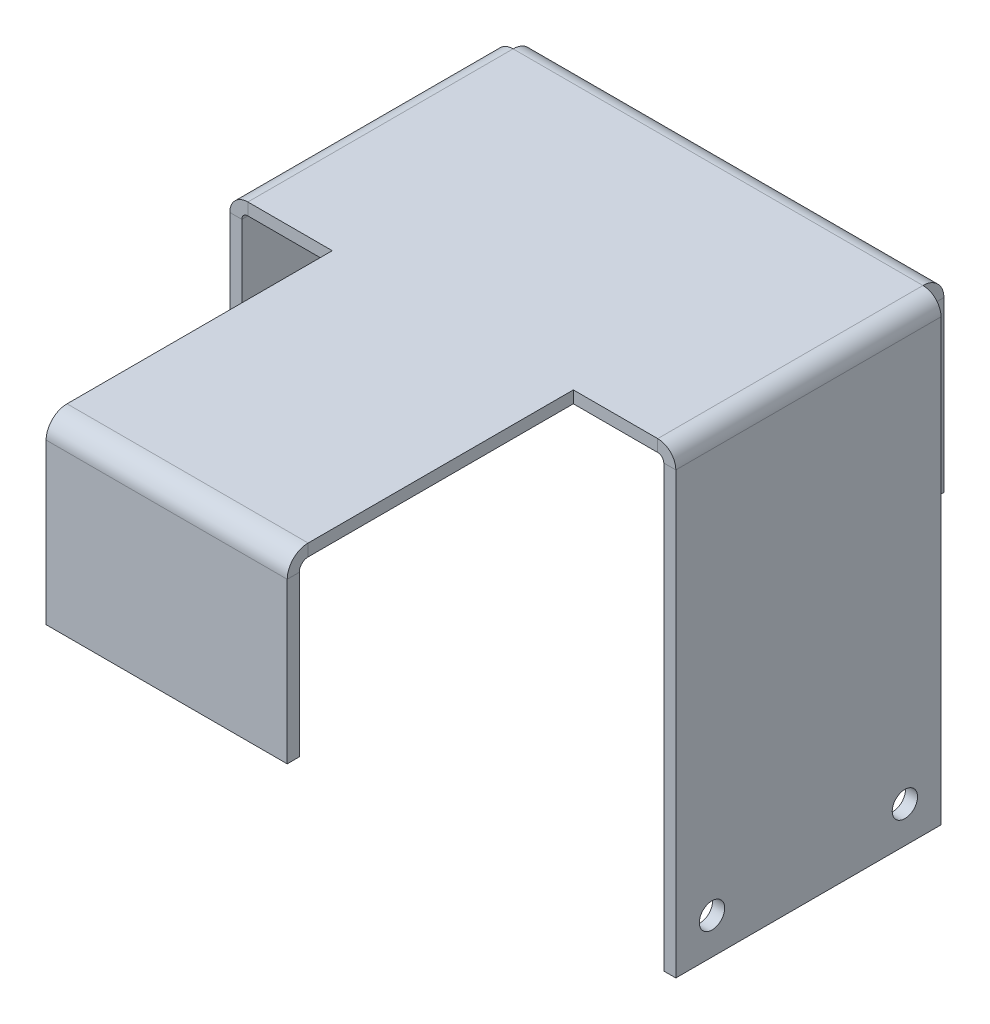
from build123d import *

# Parameters (mm, degrees)
SKETCH_1_W                       = 35
SKETCH_1_H                       = 22
SM_BASE_FLANGE_1_DEPTH           = 1
SM_EDGE_FLANGE_1_STRIP_W         = 5
SM_EDGE_FLANGE_1_STRIP_H         = 1
SM_EDGE_FLANGE_1_STRIP_CUT_DEPTH = 22
SM_EDGE_FLANGE_1_DEPTH           = 22
SM_EDGE_FLANGE_2_STRIP_W         = 5
SM_EDGE_FLANGE_2_STRIP_H         = 1
SM_EDGE_FLANGE_2_STRIP_CUT_DEPTH = 22
SM_EDGE_FLANGE_2_DEPTH           = 22
SM_EDGE_FLANGE_3_DEPTH           = 34
EXTRUDE_1_DEPTH                  = 22
SM_EDGE_FLANGE_4_DEPTH           = 20
SM_EDGE_FLANGE_5_STRIP_CUT_DEPTH = 22
SM_EDGE_FLANGE_5_DEPTH           = 22
CUT_EXTRUDE_1_DEPTH              = 22
SKETCH_27_R                      = 1.05
CUT_EXTRUDE_2_DEPTH              = 22


# Sheet-metal steps are written as plain solids
with BuildPart() as part:
    # Sketch 1 → 基体-法兰1 (new body)
    with BuildSketch(Plane(origin=(0, 0, 0), x_dir=(1, 0, 0), z_dir=(0, 1, 0))):
        Rectangle(SKETCH_1_W, SKETCH_1_H)
    extrude(amount=-SM_BASE_FLANGE_1_DEPTH)

    # 边线-法兰1 strip (across the edge) → 边线-法兰1 strip cut (cut)
    with BuildSketch(Plane(origin=(-17.5, -1, 11), x_dir=(1, 0, 0), z_dir=(0, 0, -1))):
        with Locations((-2, -0.5)):
            Rectangle(SM_EDGE_FLANGE_1_STRIP_W, SM_EDGE_FLANGE_1_STRIP_H)
    extrude(amount=SM_EDGE_FLANGE_1_STRIP_CUT_DEPTH, mode=Mode.SUBTRACT)

    # 边线-法兰1 section (across the edge) → 边线-法兰1 (add)
    with BuildSketch(Plane(origin=(-17.5, -1, 11), x_dir=(1, 0, 0), z_dir=(0, 0, -1))):
        with BuildLine():
            Line((-1, 0.5), (-1, 19))
            Line((-1, 19), (0, 19))
            Line((0, 19), (0, 0.5))
            ThreePointArc((0, 0.5), (0.146446609, 0.146446609), (0.5, 0))
            Line((0.5, 0), (0.5, -1))
            ThreePointArc((0.5, -1), (-0.560660172, -0.560660172), (-1, 0.5))
        make_face()
    extrude(amount=SM_EDGE_FLANGE_1_DEPTH)

    # 边线-法兰2 strip (across the edge) → 边线-法兰2 strip cut (cut)
    with BuildSketch(Plane(origin=(17.5, -1, -11), x_dir=(-1, 0, 0), z_dir=(0, 0, 1))):
        with Locations((-2, -0.5)):
            Rectangle(SM_EDGE_FLANGE_2_STRIP_W, SM_EDGE_FLANGE_2_STRIP_H)
    extrude(amount=SM_EDGE_FLANGE_2_STRIP_CUT_DEPTH, mode=Mode.SUBTRACT)

    # 边线-法兰2 section (across the edge) → 边线-法兰2 (add)
    with BuildSketch(Plane(origin=(17.5, -1, -11), x_dir=(-1, 0, 0), z_dir=(0, 0, 1))):
        with BuildLine():
            Line((-1, 0.5), (-1, 37))
            Line((-1, 37), (0, 37))
            Line((0, 37), (0, 0.5))
            ThreePointArc((0, 0.5), (0.146446609, 0.146446609), (0.5, 0))
            Line((0.5, 0), (0.5, -1))
            ThreePointArc((0.5, -1), (-0.560660172, -0.560660172), (-1, 0.5))
        make_face()
    extrude(amount=SM_EDGE_FLANGE_2_DEPTH)

    # 边线-法兰3 section (across the edge) → 边线-法兰3 (add)
    with BuildSketch(Plane(origin=(-17, -1, -11.7366), x_dir=(0, 0, 1), z_dir=(1, 0, 0))):
        with BuildLine():
            Line((-1, 0.7366), (-1, 14.7366))
            Line((-1, 14.7366), (0, 14.7366))
            Line((0, 14.7366), (0, 0.7366))
            ThreePointArc((0, 0.7366), (0.215745145, 0.215745145), (0.7366, 0))
            Line((0.7366, 0), (0.7366, -1))
            ThreePointArc((0.7366, -1), (-0.491361636, -0.491361636), (-1, 0.7366))
        make_face()
    extrude(amount=SM_EDGE_FLANGE_3_DEPTH)

    # 草图19 → 凸台-拉伸1 (add)
    with BuildSketch(Plane.XY.offset(11)):
        Polygon((0, 0), (10, 0), (10, -1), (-10, -1), (-10, 0), align=None)
    extrude(amount=EXTRUDE_1_DEPTH)

    # 边线-法兰4 section (across the edge) → 边线-法兰4 (add)
    with BuildSketch(Plane(origin=(10, -1, 33.7366), x_dir=(0, 0, -1), z_dir=(-1, 0, 0))):
        with BuildLine():
            Line((-1, 0.7366), (-1, 14))
            Line((-1, 14), (0, 14))
            Line((0, 14), (0, 0.7366))
            ThreePointArc((0, 0.7366), (0.215745145, 0.215745145), (0.7366, 0))
            Line((0.7366, 0), (0.7366, -1))
            ThreePointArc((0.7366, -1), (-0.491361636, -0.491361636), (-1, 0.7366))
        make_face()
    extrude(amount=SM_EDGE_FLANGE_4_DEPTH)

    # 边线-法兰5 strip (across the edge) → 边线-法兰5 strip cut (cut)
    with BuildSketch(Plane(origin=(-18.5, -20, -11), x_dir=(-0.8660254037844398, 0.4999999999999981, 0), z_dir=(0, 0, 1))):
        Polygon((-3.503939716, 4.069001615), (-0.767339716, -0.670928625), (0.098685688, -0.170928625), (-2.637914312, 4.569001615), align=None)
    extrude(amount=SM_EDGE_FLANGE_5_STRIP_CUT_DEPTH, mode=Mode.SUBTRACT)

    # 边线-法兰5 section (across the edge) → 边线-法兰5 (add)
    with BuildSketch(Plane(origin=(-18.5, -20, -11), x_dir=(-0.8660254037844398, 0.4999999999999981, 0), z_dir=(0, 0, 1))):
        with BuildLine():
            Line((-1, 0.197371375), (-1, 8.732050808))
            Line((-1, 8.732050808), (0, 8.732050808))
            Line((0, 8.732050808), (0, 0.197371375))
            ThreePointArc((0, 0.197371375), (0.025099036, 0.006725267), (0.098685688, -0.170928625))
            Line((0.098685688, -0.170928625), (-0.767339716, -0.670928625))
            ThreePointArc((-0.767339716, -0.670928625), (-0.94082679, -0.252093779), (-1, 0.197371375))
        make_face()
    extrude(amount=SM_EDGE_FLANGE_5_DEPTH)

    # 草图26 → 切除-拉伸1 (cut)
    with BuildSketch(Plane(origin=(-5.214745962, 3.010734985, 0), x_dir=(0, 0, 1), z_dir=(-0.8660254037844398, 0.49999999999999806, 0))):
        with BuildLine():
            Line((-4.3, -29.902558883), (4.3, -29.902558883))
            ThreePointArc((4.3, -29.902558883), (5.5, -31.102558883), (4.3, -32.302558883))
            Line((4.3, -32.302558883), (-4.3, -32.302558883))
            ThreePointArc((-4.3, -32.302558883), (-5.5, -31.102558883), (-4.3, -29.902558883))
        make_face()
    extrude(amount=-CUT_EXTRUDE_1_DEPTH, mode=Mode.SUBTRACT)

    # 草图27 → 切除-拉伸2 (cut)
    with BuildSketch(Plane(origin=(18.5, 0, 0), x_dir=(0, 0, -1), z_dir=(1, 0, 0))):
        with Locations(Location((8, -35, 0), (0, 0, 90))):
            Circle(SKETCH_27_R)
        with Locations(Location((-8, -35, 0), (0, 0, 90))):
            Circle(SKETCH_27_R)
    extrude(amount=-CUT_EXTRUDE_2_DEPTH, mode=Mode.SUBTRACT)


solid = part.part
